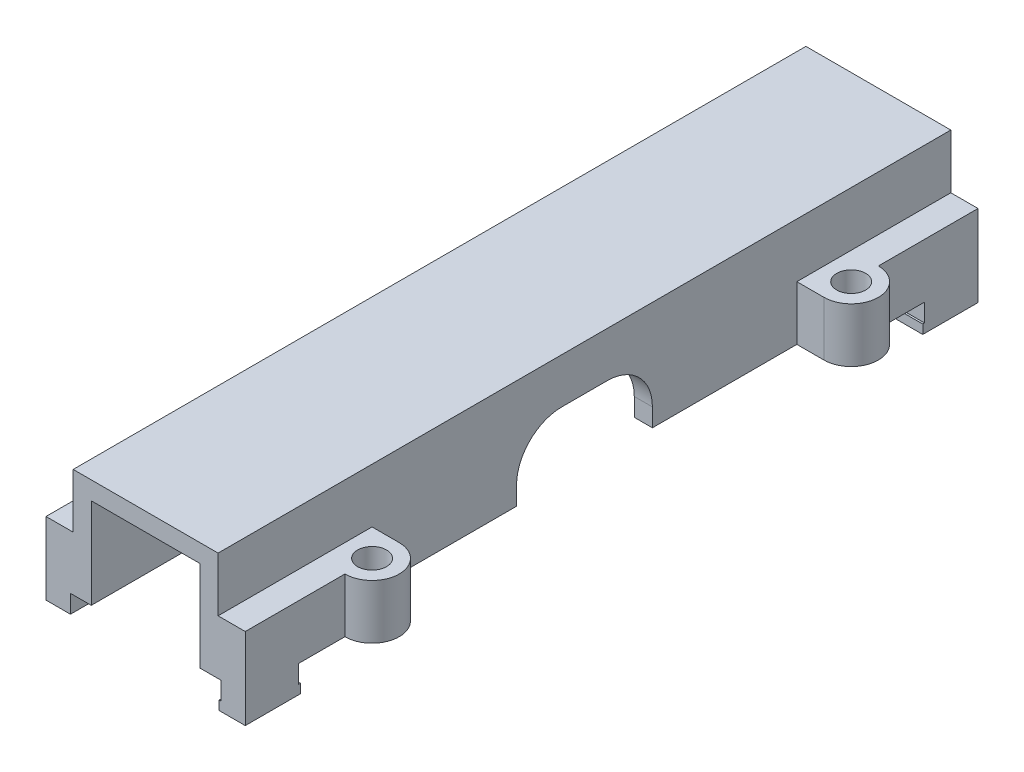
from build123d import *

# Parameters (mm, degrees)
BOSS_EXTRUDE1_DEPTH      = 34.25
BOSS_EXTRUDE2_DEPTH      = 6.2
BOSS_EXTRUDE3_DEPTH      = 6.2
SKETCH9_R                = 1.6
BOSS_EXTRUDE4_DEPTH      = 5
CUT_EXTRUDE1_START       = -16
SKETCH10_W               = 15
SKETCH10_H               = 7
CUT_EXTRUDE1_DEPTH       = 16
SKETCH11_W               = 12
SKETCH11_H               = 2
BOSS_EXTRUDE5_DEPTH      = 2
FILLET1_R                = 6
BOSS_EXTRUDE6_DEPTH      = 3
BOSS_EXTRUDE7_DEPTH      = 2
BOSS_EXTRUDE8_DEPTH      = 2
CIRPATTERN1_COUNT        = 2
FILLET2_R                = 0.5
FILLET4_R                = 5
BOSS_EXTRUDE9_DEPTH      = 6.1
BOSS_EXTRUDE10_START     = -5
BOSS_EXTRUDE10_OUTLINE_W = 3
BOSS_EXTRUDE10_OUTLINE_H = 4.9
BOSS_EXTRUDE10_DEPTH     = 5
SKETCH17_W               = 3
SKETCH17_H               = 4.9
BOSS_EXTRUDE11_DEPTH     = 5
BOSS_EXTRUDE12_START     = -5
BOSS_EXTRUDE12_OUTLINE_W = 3
BOSS_EXTRUDE12_OUTLINE_H = 5.4
BOSS_EXTRUDE12_DEPTH     = 5
CUT_EXTRUDE2_DEPTH       = 2
SKETCH21_R               = 1.6
BOSS_EXTRUDE13_DEPTH     = 1


# Read off the part's stored shape, not the designer's step: Boss-Extrude10, Boss-Extrude12
# Some blends are built 0.0001 mm under size
with BuildPart() as part:
    # Sketch1 → Boss-Extrude1 (new, symmetric)
    with BuildSketch(Plane.XY):
        Polygon((-8, -5), (-8, 7), (8, 7), (8, -5), (6, -5), (6, 5), (-6, 5), (-6, -5), align=None)
    extrude(amount=BOSS_EXTRUDE1_DEPTH, both=True)

    # Sketch6 → Boss-Extrude2 (add)
    with BuildSketch(Plane.XY.offset(34.25)):
        Polygon((6, 5), (6, -5), (8, -5), (8, 7), (-8, 7), (-8, -5), (-6, -5), (-6, 5), align=None)
    extrude(amount=BOSS_EXTRUDE2_DEPTH)

    # Sketch8 → Boss-Extrude3 (add)
    with BuildSketch(Plane(origin=(0, 0, -34.25), x_dir=(-1, 0, 0), z_dir=(0, 0, -1))):
        Polygon((-6, -5), (-6, 5), (6, 5), (6, -5), (8, -5), (8, 7), (-8, 7), (-8, -5), align=None)
    extrude(amount=BOSS_EXTRUDE3_DEPTH)

    # Sketch9 → Boss-Extrude4 (add)
    # profile 1 of 4: a face of its own
    with BuildSketch(Plane.XZ.offset(5)):
        with BuildLine():
            Line((-11, 29.45), (-6, 29.45))
            Line((-6, 29.45), (-6, 23.45))
            Line((-6, 23.45), (-11, 23.45))
            ThreePointArc((-11, 23.45), (-14, 26.45), (-11, 29.45))
        make_face()
        with Locations(Location((-11, 26.45, 0), (0, 0, 270))):
            Circle(SKETCH9_R, mode=Mode.SUBTRACT)
    # profile 2 of 4: a face of its own
    with BuildSketch(Plane.XZ.offset(5)):
        with BuildLine():
            Line((11, 29.45), (6, 29.45))
            Line((6, 29.45), (6, 23.45))
            Line((6, 23.45), (11, 23.45))
            ThreePointArc((11, 23.45), (14, 26.45), (11, 29.45))
        make_face()
        with Locations(Location((11, 26.45, 0), (0, 0, 270))):
            Circle(SKETCH9_R, mode=Mode.SUBTRACT)
    # profile 3 of 4: a face of its own
    with BuildSketch(Plane.XZ.offset(5)):
        with BuildLine():
            Line((6, -23.45), (11, -23.45))
            ThreePointArc((11, -23.45), (14, -26.45), (11, -29.45))
            Line((11, -29.45), (6, -29.45))
            Line((6, -29.45), (6, -23.45))
        make_face()
        with Locations(Location((11, -26.45, 0), (0, 0, 90))):
            Circle(SKETCH9_R, mode=Mode.SUBTRACT)
    # profile 4 of 4: a face of its own
    with BuildSketch(Plane.XZ.offset(5)):
        with BuildLine():
            Line((-6, -23.45), (-11, -23.45))
            ThreePointArc((-11, -23.45), (-14, -26.45), (-11, -29.45))
            Line((-11, -29.45), (-6, -29.45))
            Line((-6, -29.45), (-6, -23.45))
        make_face()
        with Locations(Location((-11, -26.45, 0), (0, 0, 90))):
            Circle(SKETCH9_R, mode=Mode.SUBTRACT)
    extrude(amount=-BOSS_EXTRUDE4_DEPTH)

    # Sketch10 → Cut-Extrude1 (cut)
    with BuildSketch(Plane.ZY.offset(8).offset(CUT_EXTRUDE1_START)):
        with Locations((0, -1.5)):
            Rectangle(SKETCH10_W, SKETCH10_H)
    extrude(amount=CUT_EXTRUDE1_DEPTH, mode=Mode.SUBTRACT)

    # Sketch11 → Boss-Extrude5 (add)
    with BuildSketch(Plane(origin=(0, 0, 7.5), x_dir=(-1, 0, 0), z_dir=(0, 0, -1))):
        with Locations((0, 4)):
            Rectangle(SKETCH11_W, SKETCH11_H)
    boss_extrude5 = extrude(amount=-BOSS_EXTRUDE5_DEPTH)

    # Mirror1: Boss-Extrude5 across plane
    add(boss_extrude5.mirror(Plane.XY))

    # Fillet1
    # the kernel refuses this fillet: 6 mm, written as the material it adds along each edge
    with BuildSketch(Plane(origin=(-6, 3, -7.5), x_dir=(0, -1, 0), z_dir=(0, 0, -1)), Plane(origin=(6, 3, 7.5), x_dir=(0, -1, 0), z_dir=(0, 0, 1))) as fillet1_piece_1:
        with BuildLine():
            CenterArc((FILLET1_R, -FILLET1_R), FILLET1_R, 90, 90)
            Line((0, -FILLET1_R), (0, 0))
            Line((0, 0), (FILLET1_R, 0))
        make_face()
    extrude(amount=2)
    with BuildSketch(Plane(origin=(6, 3, -7.5), x_dir=(0, -1, 0), z_dir=(0, 0, -1)), Plane(origin=(-6, 3, 7.5), x_dir=(0, -1, 0), z_dir=(0, 0, 1))) as fillet1_piece_2:
        with BuildLine():
            CenterArc((FILLET1_R, FILLET1_R), FILLET1_R, 180, 90)
            Line((0, FILLET1_R), (0, 0))
            Line((0, 0), (FILLET1_R, 0))
        make_face()
    extrude(amount=2)

    # Sketch12 → Boss-Extrude6 (add)
    with BuildSketch(Plane.XY.offset(39.45)):
        Polygon((2.5, 5), (2.5, 4.8), (5.8, 4.8), (5.8, 1.8), (6, 1.8), (6, 5), align=None)
    boss_extrude6 = extrude(amount=-BOSS_EXTRUDE6_DEPTH)

    # Sketch13 → Boss-Extrude7 (add)
    with BuildSketch(Plane(origin=(0, 0, 35.45), x_dir=(-1, 0, 0), z_dir=(0, 0, -1))):
        Polygon((-2.5, 5), (-6, 5), (-6, 1.8), (-5.8, 1.8), (-5.8, 4.8), (-2.5, 4.8), align=None)
    boss_extrude7 = extrude(amount=BOSS_EXTRUDE7_DEPTH)

    # Sketch14 → Boss-Extrude8 (add)
    with BuildSketch(Plane(origin=(0, 0, 32.45), x_dir=(-1, 0, 0), z_dir=(0, 0, -1))):
        Polygon((-6, 5), (-4.25, 5), (-4.25, 4.8), (-5.8, 4.8), (-5.8, 3.4), (-6, 3.4), align=None)
        Polygon((5.8, 3.4), (5.8, 4.8), (4.25, 4.8), (4.25, 5), (6, 5), (6, 3.4), align=None)
    boss_extrude8 = extrude(amount=BOSS_EXTRUDE8_DEPTH)

    # CirPattern1: Boss-Extrude6, Boss-Extrude7, Boss-Extrude8 ×2 about axis
    cirpattern1_axis = Axis((0, 0, 0), (0, 1, 0))
    add([boss_extrude6.rotate(cirpattern1_axis, i * 360 / CIRPATTERN1_COUNT) for i in range(1, CIRPATTERN1_COUNT)])
    add([boss_extrude7.rotate(cirpattern1_axis, i * 360 / CIRPATTERN1_COUNT) for i in range(1, CIRPATTERN1_COUNT)])
    add([boss_extrude8.rotate(cirpattern1_axis, i * 360 / CIRPATTERN1_COUNT) for i in range(1, CIRPATTERN1_COUNT)])

    # Fillet2
    fillet2_edges = [part.edges().sort_by_distance(p)[0] for p in [
        (5.8, 4.8, 37.95),
        (5.8, 4.8, 34.45),
        (5.8, 4.8, 31.45),
        (-5.8, 4.8, 31.45),
        (-5.8, 4.8, -37.95),
        (-5.8, 4.8, -34.45),
        (-5.8, 4.8, -31.45),
        (5.8, 4.8, -31.45),
    ]]
    fillet(fillet2_edges, radius=FILLET2_R)

    # Fillet4
    fillet4_edges = [part.edges().sort_by_distance(p)[0] for p in [
        (7, 2, -7.5),
        (-7, 2, -7.5),
        (7, 2, 7.5),
        (-7, 2, 7.5),
    ]]
    fillet(fillet4_edges, radius=FILLET4_R - 0.0001)  # a hair under: the kernel refuses the full size

    # Sketch15 → Boss-Extrude9 (add)
    with BuildSketch(Plane.XY.offset(40.45)):
        Polygon((8, -5), (8.1, -5), (8.1, -8), (11, -8), (11, 0), (8, 0), align=None)
        Polygon((-8, -5), (-8.1, -5), (-8.1, -7), (-11, -7), (-11, 0), (-8, 0), align=None)
    boss_extrude9 = extrude(amount=-BOSS_EXTRUDE9_DEPTH)

    # Boss-Extrude10 outline → Boss-Extrude10 (add)
    with BuildSketch(Plane(origin=(0, 0, 0), x_dir=(1, 0, 0), z_dir=(0, 1, 0)).offset(BOSS_EXTRUDE10_START)):
        with Locations((9.5, -31.9)):
            Rectangle(BOSS_EXTRUDE10_OUTLINE_W, BOSS_EXTRUDE10_OUTLINE_H)
        with Locations((-9.5, -31.9)):
            Rectangle(BOSS_EXTRUDE10_OUTLINE_W, BOSS_EXTRUDE10_OUTLINE_H)
    extrude(amount=BOSS_EXTRUDE10_DEPTH)

    # Mirror3: Boss-Extrude9 across plane
    add(boss_extrude9.mirror(Plane.XY))

    # Sketch17 → Boss-Extrude11 (add)
    with BuildSketch(Plane(origin=(0, 0, 0), x_dir=(1, 0, 0), z_dir=(0, 1, 0))):
        with Locations((-9.5, 31.9)):
            Rectangle(SKETCH17_W, SKETCH17_H)
        with Locations((9.5, 31.9)):
            Rectangle(SKETCH17_W, SKETCH17_H)
    extrude(amount=-BOSS_EXTRUDE11_DEPTH)

    # Boss-Extrude12 outline → Boss-Extrude12 (add)
    with BuildSketch(Plane.XZ.offset(5).offset(BOSS_EXTRUDE12_START)):
        with Locations((-9.5, -20.75)):
            Rectangle(BOSS_EXTRUDE12_OUTLINE_W, BOSS_EXTRUDE12_OUTLINE_H)
        with Locations((-9.5, 20.75)):
            Rectangle(BOSS_EXTRUDE12_OUTLINE_W, BOSS_EXTRUDE12_OUTLINE_H)
    extrude(amount=BOSS_EXTRUDE12_DEPTH)

    # Sketch20 → Cut-Extrude2 (cut)
    with BuildSketch(Plane.XZ.offset(7)):
        Polygon((-8.3, -34.35), (-11, -34.35), (-11, -34.55), (-8.3, -34.55), (-8.3, -40.45), (-8.1, -40.45), (-8.1, -34.55), (-8.1, -34.35), align=None)
        Polygon((8.3, 40.45), (8.1, 40.45), (8.1, 34.55), (8.1, 34.35), (8.3, 34.35), (11, 34.35), (11, 34.55), (8.3, 34.55), align=None)
        Polygon((8.1, -34.35), (11, -34.35), (11, -34.55), (8.3, -34.55), (8.3, -40.45), (8.1, -40.45), align=None)
        Polygon((-11, 34.35), (-8.1, 34.35), (-8.1, 40.45), (-8.3, 40.45), (-8.3, 34.55), (-11, 34.55), align=None)
    extrude(amount=-CUT_EXTRUDE2_DEPTH, mode=Mode.SUBTRACT)

    # Sketch21 → Boss-Extrude13 (add)
    # profile 1 of 4: a face of its own
    with BuildSketch(Plane(origin=(0, 0, 0), x_dir=(1, 0, 0), z_dir=(0, 1, 0))):
        with BuildLine():
            Line((-11, -29.45), (-11, -40.45))
            Line((-11, -40.45), (-8, -40.45))
            Line((-8, -40.45), (-8, -18.05))
            Line((-8, -18.05), (-11, -18.05))
            Line((-11, -18.05), (-11, -23.45))
            ThreePointArc((-11, -23.45), (-14, -26.45), (-11, -29.45))
        make_face()
        with Locations(Location((-11, -26.45, 0), (0, 0, 90))):
            Circle(SKETCH21_R, mode=Mode.SUBTRACT)
    # profile 2 of 4: a face of its own
    with BuildSketch(Plane(origin=(0, 0, 0), x_dir=(1, 0, 0), z_dir=(0, 1, 0))):
        with BuildLine():
            Line((11, -23.45), (8, -23.45))
            Line((8, -23.45), (8, -40.45))
            Line((8, -40.45), (11, -40.45))
            Line((11, -40.45), (11, -29.45))
            ThreePointArc((11, -29.45), (14, -26.45), (11, -23.45))
        make_face()
        with Locations(Location((11, -26.45, 0), (0, 0, 90))):
            Circle(SKETCH21_R, mode=Mode.SUBTRACT)
    # profile 3 of 4: a face of its own
    with BuildSketch(Plane(origin=(0, 0, 0), x_dir=(1, 0, 0), z_dir=(0, 1, 0))):
        with BuildLine():
            Line((8, 40.45), (8, 23.45))
            Line((8, 23.45), (11, 23.45))
            ThreePointArc((11, 23.45), (14, 26.45), (11, 29.45))
            Line((11, 29.45), (11, 40.45))
            Line((11, 40.45), (8, 40.45))
        make_face()
        with Locations(Location((11, 26.45, 0), (0, 0, 270))):
            Circle(SKETCH21_R, mode=Mode.SUBTRACT)
    # profile 4 of 4: a face of its own
    with BuildSketch(Plane(origin=(0, 0, 0), x_dir=(1, 0, 0), z_dir=(0, 1, 0))):
        with BuildLine():
            Line((-8, 18.05), (-8, 40.45))
            Line((-8, 40.45), (-11, 40.45))
            Line((-11, 40.45), (-11, 29.45))
            ThreePointArc((-11, 29.45), (-14, 26.45), (-11, 23.45))
            Line((-11, 23.45), (-11, 18.05))
            Line((-11, 18.05), (-8, 18.05))
        make_face()
        with Locations(Location((-11, 26.45, 0), (0, 0, 270))):
            Circle(SKETCH21_R, mode=Mode.SUBTRACT)
    extrude(amount=BOSS_EXTRUDE13_DEPTH)


solid = part.part
